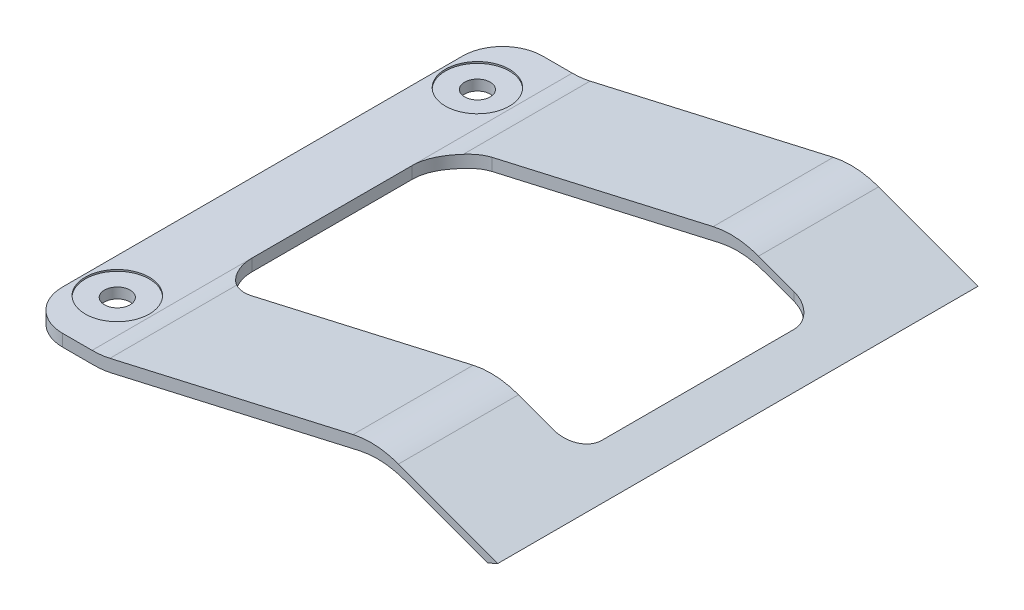
from build123d import *

# Parameters (mm, degrees)
EXTRUDE_1_DEPTH                 = 60
FILLET_1_R                      = 10
CHAMFER_1_SIZE                  = 2
CHAMFER_1_SIZE_2                = 1.558687347
CUT_EXTRUDE_1_REACH             = 86.761
SKETCH_2_R                      = 1.6
SKETCH_3_R                      = 4
CUT_EXTRUDE_2_DEPTH             = 0.2
CUT_EXTRUDE_3_REACH             = 86.761
SKETCH_4_W                      = 45.702932162
SKETCH_4_H                      = 30
CUT_EXTRUDE_3_DIRECTION_2_REACH = 86.761
FILLET_2_OUTLINE_W              = 8.702446171
FILLET_2_OUTLINE_H              = 1.5
FILLET_2_DEPTH                  = 5
FILLET_START                    = 55
FILLET_2_2_OUTLINE_W            = 8.702446171
FILLET_2_2_OUTLINE_H            = 1.5
FILLET_2_2_DEPTH                = 5
FILLET_2_3_DEPTH                = 1.3
FILLET_START_2                  = 1.3
FILLET_2_4_DEPTH                = 0.2
FILLET_START_3                  = 1.478876
FILLET_2_5_DEPTH                = 0.906082345
FILLET_START_4                  = 15
FILLET_2_6_DEPTH                = 30
FILLET_3_R                      = 3


with BuildPart() as part:
    # 草图1 → 凸台-拉伸1 (new body)
    with BuildSketch(Plane.XY):
        Polygon((0, 0), (10, 0), (45, 8), (60, 2.5), (60, 3.565103021), (44.204382552, 9.356829418), (9.830753848, 1.5), (0, 1.5), align=None)
    extrude(amount=EXTRUDE_1_DEPTH)

    # 圆角1
    fillet_1_edges = [part.edges().sort_by_distance(p)[0] for p in [
        (9.830753848, 1.5, 30),
        (44.204382552, 9.356829418, 30),
        (45, 8, 30),
        (10, 0, 30),
    ]]
    fillet(fillet_1_edges, radius=FILLET_1_R)

    # 倒角1
    # the kernel refuses this chamfer: 2, 1.558687347 mm, written as the material it takes off along each edge
    with BuildSketch(Plane(origin=(60, 2.5, -5.143365976), x_dir=(-0.9388763158866087, 0.3442546491584233, 0), z_dir=(0, 0, 1))) as chamfer_1_piece_1:
        Polygon((CHAMFER_1_SIZE, 0), (CHAMFER_1_SIZE_2 * 0.3442546492, -CHAMFER_1_SIZE_2 * 0.938876315999), (0, 0), align=None)
    extrude(amount=70.286731952, mode=Mode.SUBTRACT)

    # 草图2 → 切除-拉伸1 (cut, up to next)
    with BuildSketch(Plane(origin=(0, 1.5, 0), x_dir=(1, 0, 0), z_dir=(0, 1, 0)), mode=Mode.PRIVATE) as cut_extrude_1_sk1:
        with Locations(Location((4.351223085, -7.5, 0), (0, 0, 270))):
            Circle(SKETCH_2_R)
    cut_extrude_1_tool1 = extrude(cut_extrude_1_sk1.sketch, amount=-CUT_EXTRUDE_1_REACH, mode=Mode.PRIVATE) & part.part
    # 草图2 → 切除-拉伸1 (cut, up to next)
    with BuildSketch(Plane(origin=(0, 1.5, 0), x_dir=(1, 0, 0), z_dir=(0, 1, 0)), mode=Mode.PRIVATE) as cut_extrude_1_sk2:
        with Locations(Location((4.351223085, -52.5, 0), (0, 0, 270))):
            Circle(SKETCH_2_R)
    cut_extrude_1_tool2 = extrude(cut_extrude_1_sk2.sketch, amount=-CUT_EXTRUDE_1_REACH, mode=Mode.PRIVATE) & part.part
    add(cut_extrude_1_tool1.solids().sort_by_distance((4.351223, 1.5, 7.5))[0], mode=Mode.SUBTRACT)
    add(cut_extrude_1_tool2.solids().sort_by_distance((4.351223, 1.5, 52.5))[0], mode=Mode.SUBTRACT)

    # 草图3 → 切除-拉伸2 (cut)
    with BuildSketch(Plane(origin=(0, 1.5, 0), x_dir=(1, 0, 0), z_dir=(0, 1, 0))):
        with Locations(Location((4.351223085, -7.5, 0), (0, 0, 270))):
            Circle(SKETCH_3_R)
        with Locations(Location((4.351223085, -52.5, 0), (0, 0, 270))):
            Circle(SKETCH_3_R)
    extrude(amount=-CUT_EXTRUDE_2_DEPTH, mode=Mode.SUBTRACT)

    # 草图4 → 切除-拉伸3 (cut, up to next)
    with BuildSketch(Plane(origin=(0, 1.5, 0), x_dir=(1, 0, 0), z_dir=(0, 1, 0)), mode=Mode.PRIVATE) as cut_extrude_3_sk1:
        with Locations((31.553912252, -30)):
            Rectangle(SKETCH_4_W, SKETCH_4_H)
    cut_extrude_3_tool1 = extrude(cut_extrude_3_sk1.sketch, amount=-CUT_EXTRUDE_3_REACH, mode=Mode.PRIVATE) & part.part
    add(cut_extrude_3_tool1.solids().sort_by_distance((31.553912, 1.5, 30))[0], mode=Mode.SUBTRACT)

    # 草图4 → 切除-拉伸3 direction 2 (cut, up to next)
    with BuildSketch(Plane(origin=(0, 1.5, 0), x_dir=(1, 0, 0), z_dir=(0, 1, 0)), mode=Mode.PRIVATE) as cut_extrude_3_direction_2_sk1:
        with Locations((31.553912252, -30)):
            Rectangle(SKETCH_4_W, SKETCH_4_H)
    cut_extrude_3_direction_2_tool1 = extrude(cut_extrude_3_direction_2_sk1.sketch, amount=CUT_EXTRUDE_3_DIRECTION_2_REACH, mode=Mode.PRIVATE) & part.part
    add(cut_extrude_3_direction_2_tool1.solids().sort_by_distance((31.553912, 1.5, 30))[0], mode=Mode.SUBTRACT)

    # 圆角2: read off the stored shape, not the designer's step
    # 圆角2 outline → 圆角2 (cut)
    with BuildSketch(Plane.XY):
        with Locations((4.351223086, 0.75)):
            Rectangle(FILLET_2_OUTLINE_W, FILLET_2_OUTLINE_H)
    extrude(amount=FILLET_2_DEPTH, mode=Mode.SUBTRACT)

    # Fillet 2 2 outline → Fillet 2 2 (cut)
    with BuildSketch(Plane.XY.offset(FILLET_START)):
        with Locations((4.351223086, 0.75)):
            Rectangle(FILLET_2_2_OUTLINE_W, FILLET_2_2_OUTLINE_H)
    extrude(amount=FILLET_2_2_DEPTH, mode=Mode.SUBTRACT)

    # Fillet 2 3 outline → Fillet 2 3 (add)
    with BuildSketch(Plane(origin=(0, 0, 0), x_dir=(1, 0, 0), z_dir=(0, 1, 0))):
        with BuildLine():
            Line((5, -60), (8.702446171, -60))
            Line((8.702446171, -60), (8.702446171, -55))
            Line((8.702446171, -55), (0, -55))
            ThreePointArc((0, -55), (1.464466094, -58.535533906), (5, -60))
        make_face()
        with BuildLine():
            Line((8.702446171, -5), (8.702446171, 0))
            Line((8.702446171, 0), (5, 0))
            ThreePointArc((5, 0), (1.464466094, -1.464466094), (0, -5))
            Line((0, -5), (8.702446171, -5))
        make_face()
        with BuildLine():
            ThreePointArc((13.702446171, -45), (10.166912265, -43.535533906), (8.702446171, -40))
            Line((8.702446171, -40), (8.702446171, -45))
            Line((8.702446171, -45), (13.702446171, -45))
        make_face()
        with BuildLine():
            ThreePointArc((8.702446171, -20), (10.166912265, -16.464466094), (13.702446171, -15))
            Line((13.702446171, -15), (8.702446171, -15))
            Line((8.702446171, -15), (8.702446171, -20))
        make_face()
    extrude(amount=FILLET_2_3_DEPTH)

    # Fillet 2 4 outline → Fillet 2 4 (add)
    with BuildSketch(Plane(origin=(0, 0, 0), x_dir=(1, 0, 0), z_dir=(0, 1, 0)).offset(FILLET_START_2)):
        with BuildLine():
            Line((5, -60), (8.702446171, -60))
            Line((8.702446171, -60), (8.702446171, -55))
            Line((8.702446171, -55), (7.473722084, -55))
            ThreePointArc((7.473722084, -55), (4.351223085, -56.5), (1.228724086, -55))
            Line((1.228724086, -55), (0, -55))
            ThreePointArc((0, -55), (1.464466094, -58.535533906), (5, -60))
        make_face()
        with BuildLine():
            Line((8.702446171, -5), (8.702446171, 0))
            Line((8.702446171, 0), (5, 0))
            ThreePointArc((5, 0), (1.464466094, -1.464466094), (0, -5))
            Line((0, -5), (1.228724086, -5))
            ThreePointArc((1.228724086, -5), (4.351223085, -3.5), (7.473722084, -5))
            Line((7.473722084, -5), (8.702446171, -5))
        make_face()
        with BuildLine():
            ThreePointArc((13.702446171, -45), (10.166912265, -43.535533906), (8.702446171, -40))
            Line((8.702446171, -40), (8.702446171, -45))
            Line((8.702446171, -45), (13.702446171, -45))
        make_face()
        with BuildLine():
            ThreePointArc((8.702446171, -20), (10.166912265, -16.464466094), (13.702446171, -15))
            Line((13.702446171, -15), (8.702446171, -15))
            Line((8.702446171, -15), (8.702446171, -20))
        make_face()
    extrude(amount=FILLET_2_4_DEPTH)

    # Fillet 2 5 outline → Fillet 2 5 (add)
    with BuildSketch(Plane(origin=(0, 0, 0), x_dir=(1, 0, 0), z_dir=(0, 1, 0)).offset(FILLET_START_3)):
        with BuildLine():
            ThreePointArc((13.702446171, -45), (10.166912265, -43.535533906), (8.702446171, -40))
            Line((8.702446171, -40), (8.702446171, -45))
            Line((8.702446171, -45), (13.702446171, -45))
        make_face()
        with BuildLine():
            ThreePointArc((8.702446171, -20), (10.166912265, -16.464466094), (13.702446171, -15))
            Line((13.702446171, -15), (8.702446171, -15))
            Line((8.702446171, -15), (8.702446171, -20))
        make_face()
    extrude(amount=FILLET_2_5_DEPTH)

    # Fillet 2 6 outline → Fillet 2 6 (cut)
    with BuildSketch(Plane.XY.offset(FILLET_START_4)):
        with BuildLine():
            Line((10.930694186, 1.751414934), (13.702446193, 2.38495825))
            Line((13.702446193, 2.38495825), (8.702446171, 2.384958345))
            Line((8.702446171, 2.384958345), (8.702446171, 1.5))
            ThreePointArc((8.702446171, 1.5), (9.823639585, 1.563052515), (10.930694186, 1.751414934))
        make_face()
        with BuildLine():
            Line((8.871692322, 0), (13.702446171, 0))
            Line((13.702446171, 0), (13.702446171, 0.846273411))
            Line((13.702446171, 0.846273411), (11.099940337, 0.251414934))
            ThreePointArc((11.099940337, 0.251414934), (9.992885736, 0.063052515), (8.871692322, 0))
        make_face()
    extrude(amount=FILLET_2_6_DEPTH, mode=Mode.SUBTRACT)

    # 圆角3
    # the kernel refuses this fillet: 3 mm, written as the material it adds along each edge
    with BuildSketch(Plane(origin=(54.405378333, -2.948638722, 45), x_dir=(-1, 0, 0), z_dir=(0, 1, 0))) as fillet_3_piece_1_section:
        with BuildLine():
            CenterArc((FILLET_3_R, -FILLET_3_R), FILLET_3_R, 90, 90)
            Line((0, -FILLET_3_R), (0, 0))
            Line((0, 0), (FILLET_3_R, 0))
        make_face()
    fillet_3_piece_1 = extrude(amount=16.065103021, mode=Mode.PRIVATE)
    fillet_3_piece_1 = split(fillet_3_piece_1, bisect_by=Plane(origin=(56.829472359, 3.662526802, 45), z_dir=(0.34425464915842324, 0.9388763158866087, 0)), keep=Keep.TOP, mode=Mode.PRIVATE)
    fillet_3_piece_1 = split(fillet_3_piece_1, bisect_by=Plane(origin=(57.173727008, 4.601403118, 45), z_dir=(-0.344254649158423, -0.9388763158866088, 0)), keep=Keep.TOP, mode=Mode.PRIVATE)
    add(fillet_3_piece_1)
    with BuildSketch(Plane(origin=(54.405378333, -2.948638722, 15), x_dir=(-1, 0, 0), z_dir=(0, 1, 0))) as fillet_3_piece_2_section:
        with BuildLine():
            CenterArc((FILLET_3_R, FILLET_3_R), FILLET_3_R, 180, 90)
            Line((0, FILLET_3_R), (0, 0))
            Line((0, 0), (FILLET_3_R, 0))
        make_face()
    fillet_3_piece_2 = extrude(amount=16.065103021, mode=Mode.PRIVATE)
    fillet_3_piece_2 = split(fillet_3_piece_2, bisect_by=Plane(origin=(57.173727008, 4.601403118, 15), z_dir=(-0.344254649158423, -0.9388763158866088, 0)), keep=Keep.TOP, mode=Mode.PRIVATE)
    fillet_3_piece_2 = split(fillet_3_piece_2, bisect_by=Plane(origin=(56.829472359, 3.662526802, 15), z_dir=(0.34425464915842324, 0.9388763158866087, 0)), keep=Keep.TOP, mode=Mode.PRIVATE)
    add(fillet_3_piece_2)


solid = part.part
